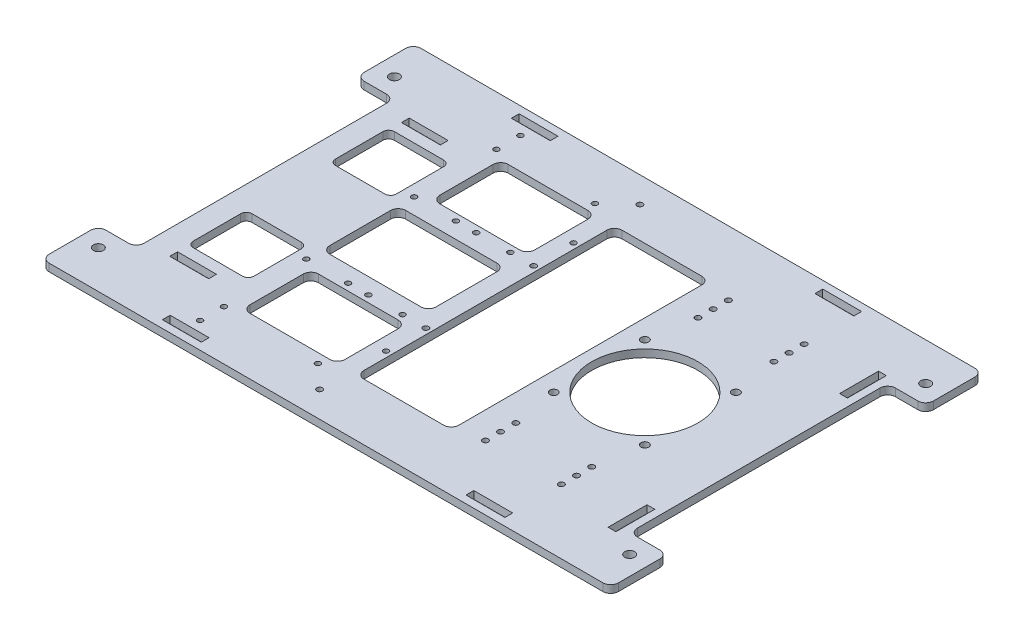
from build123d import *

# Parameters (mm, degrees)
SKETCH_1_R             = 28
SKETCH_1_R_2           = 2.6
SM_BASE_FLANGE_1_DEPTH = 4
CUT_EXTRUDE_1_REACH    = 360.374
SKETCH_6_W             = 4.1
SKETCH_6_H             = 20.5
SKETCH_6_W_2           = 20.5
SKETCH_6_H_2           = 4.1
CUT_EXTRUDE_2_REACH    = 360.374
SKETCH_7_R             = 2.05
SKETCH_14_R            = 1.4
SKETCH_14_R_2          = 1.494707745
SKETCH_14_R_3          = 1.476153091
CUT_EXTRUDE_3_DEPTH    = 359.374106207
SKETCH_15_R            = 1.5
CUT_EXTRUDE_4_DEPTH    = 359.374106207


# Sheet-metal steps are written as plain solids
with BuildPart() as part:
    # Sketch 1 → Базовая кромка1 (new body)
    with BuildSketch(Plane(origin=(0, 0, 0), x_dir=(1, 0, 0), z_dir=(0, 1, 0))):
        with BuildLine():
            Line((0, -170.108474074), (0, -191.891525926))
            ThreePointArc((0, -191.891525926), (1.203344196, -194.796655804), (4.108474074, -196))
            Line((4.108474074, -196), (295.891525926, -196))
            ThreePointArc((295.891525926, -196), (298.796655804, -194.796655804), (300, -191.891525926))
            Line((300, -191.891525926), (300, -170.108474074))
            ThreePointArc((300, -170.108474074), (298.796655804, -167.203344196), (295.891525926, -166))
            Line((295.891525926, -166), (284.108474074, -166))
            ThreePointArc((284.108474074, -166), (281.203344196, -164.796655804), (280, -161.891525926))
            Line((280, -161.891525926), (280, -34.108474074))
            ThreePointArc((280, -34.108474074), (281.203344196, -31.203344196), (284.108474074, -30))
            Line((284.108474074, -30), (295.891525926, -30))
            ThreePointArc((295.891525926, -30), (298.796655804, -28.796655804), (300, -25.891525926))
            Line((300, -25.891525926), (300, -4.108474074))
            ThreePointArc((300, -4.108474074), (298.796655804, -1.203344196), (295.891525926, 0))
            Line((295.891525926, 0), (4.108474074, 0))
            ThreePointArc((4.108474074, 0), (1.203344196, -1.203344196), (0, -4.108474074))
            Line((0, -4.108474074), (0, -25.891525926))
            ThreePointArc((0, -25.891525926), (1.203344196, -28.796655804), (4.108474074, -30))
            Line((4.108474074, -30), (15.891525926, -30))
            ThreePointArc((15.891525926, -30), (18.796655804, -31.203344196), (20, -34.108474074))
            Line((20, -34.108474074), (20, -161.891525926))
            ThreePointArc((20, -161.891525926), (18.796655804, -164.796655804), (15.891525926, -166))
            Line((15.891525926, -166), (4.108474074, -166))
            ThreePointArc((4.108474074, -166), (1.203344196, -167.203344196), (0, -170.108474074))
        make_face()
        with Locations(Location((220, -98, 0), (0, 0, 270))):
            Circle(SKETCH_1_R, mode=Mode.SUBTRACT)
        with Locations(Location((10, -20, 0), (0, 0, 270))):
            Circle(SKETCH_1_R_2, mode=Mode.SUBTRACT)
        with Locations(Location((290, -20, 0), (0, 0, 270))):
            Circle(SKETCH_1_R_2, mode=Mode.SUBTRACT)
        with Locations(Location((290, -176, 0), (0, 0, 90))):
            Circle(SKETCH_1_R_2, mode=Mode.SUBTRACT)
        with Locations(Location((10, -176, 0), (0, 0, 90))):
            Circle(SKETCH_1_R_2, mode=Mode.SUBTRACT)
    extrude(amount=-SM_BASE_FLANGE_1_DEPTH)

    # Эскиз6 → Вырез-Вытянуть1 (cut, up to next)
    with BuildSketch(Plane(origin=(0, 0, 0), x_dir=(1, 0, 0), z_dir=(0, 1, 0)), mode=Mode.PRIVATE) as cut_extrude_1_sk1:
        with Locations((273.95, -37)):
            Rectangle(SKETCH_6_W, SKETCH_6_H)
    cut_extrude_1_tool1 = extrude(cut_extrude_1_sk1.sketch, amount=-CUT_EXTRUDE_1_REACH, mode=Mode.PRIVATE) & part.part
    # Эскиз6 → Вырез-Вытянуть1 (cut, up to next)
    with BuildSketch(Plane(origin=(0, 0, 0), x_dir=(1, 0, 0), z_dir=(0, 1, 0)), mode=Mode.PRIVATE) as cut_extrude_1_sk2:
        with Locations((230, -6.05)):
            Rectangle(SKETCH_6_W_2, SKETCH_6_H_2)
    cut_extrude_1_tool2 = extrude(cut_extrude_1_sk2.sketch, amount=-CUT_EXTRUDE_1_REACH, mode=Mode.PRIVATE) & part.part
    # Эскиз6 → Вырез-Вытянуть1 (cut, up to next)
    with BuildSketch(Plane(origin=(0, 0, 0), x_dir=(1, 0, 0), z_dir=(0, 1, 0)), mode=Mode.PRIVATE) as cut_extrude_1_sk3:
        with Locations((70, -6.05)):
            Rectangle(SKETCH_6_W_2, SKETCH_6_H_2)
    cut_extrude_1_tool3 = extrude(cut_extrude_1_sk3.sketch, amount=-CUT_EXTRUDE_1_REACH, mode=Mode.PRIVATE) & part.part
    # Эскиз6 → Вырез-Вытянуть1 (cut, up to next)
    with BuildSketch(Plane(origin=(0, 0, 0), x_dir=(1, 0, 0), z_dir=(0, 1, 0)), mode=Mode.PRIVATE) as cut_extrude_1_sk4:
        with Locations((43, -36.95)):
            Rectangle(SKETCH_6_W_2, SKETCH_6_H_2)
    cut_extrude_1_tool4 = extrude(cut_extrude_1_sk4.sketch, amount=-CUT_EXTRUDE_1_REACH, mode=Mode.PRIVATE) & part.part
    # Эскиз6 → Вырез-Вытянуть1 (cut, up to next)
    with BuildSketch(Plane(origin=(0, 0, 0), x_dir=(1, 0, 0), z_dir=(0, 1, 0)), mode=Mode.PRIVATE) as cut_extrude_1_sk5:
        with Locations((43, -159.05)):
            Rectangle(SKETCH_6_W_2, SKETCH_6_H_2)
    cut_extrude_1_tool5 = extrude(cut_extrude_1_sk5.sketch, amount=-CUT_EXTRUDE_1_REACH, mode=Mode.PRIVATE) & part.part
    # Эскиз6 → Вырез-Вытянуть1 (cut, up to next)
    with BuildSketch(Plane(origin=(0, 0, 0), x_dir=(1, 0, 0), z_dir=(0, 1, 0)), mode=Mode.PRIVATE) as cut_extrude_1_sk6:
        with Locations((70, -189.95)):
            Rectangle(SKETCH_6_W_2, SKETCH_6_H_2)
    cut_extrude_1_tool6 = extrude(cut_extrude_1_sk6.sketch, amount=-CUT_EXTRUDE_1_REACH, mode=Mode.PRIVATE) & part.part
    # Эскиз6 → Вырез-Вытянуть1 (cut, up to next)
    with BuildSketch(Plane(origin=(0, 0, 0), x_dir=(1, 0, 0), z_dir=(0, 1, 0)), mode=Mode.PRIVATE) as cut_extrude_1_sk7:
        with Locations((230, -189.95)):
            Rectangle(SKETCH_6_W_2, SKETCH_6_H_2)
    cut_extrude_1_tool7 = extrude(cut_extrude_1_sk7.sketch, amount=-CUT_EXTRUDE_1_REACH, mode=Mode.PRIVATE) & part.part
    # Эскиз6 → Вырез-Вытянуть1 (cut, up to next)
    with BuildSketch(Plane(origin=(0, 0, 0), x_dir=(1, 0, 0), z_dir=(0, 1, 0)), mode=Mode.PRIVATE) as cut_extrude_1_sk8:
        with Locations((273.95, -159)):
            Rectangle(SKETCH_6_W, SKETCH_6_H)
    cut_extrude_1_tool8 = extrude(cut_extrude_1_sk8.sketch, amount=-CUT_EXTRUDE_1_REACH, mode=Mode.PRIVATE) & part.part
    add(cut_extrude_1_tool1.solids().sort_by_distance((273.95, 0, 37))[0], mode=Mode.SUBTRACT)
    add(cut_extrude_1_tool2.solids().sort_by_distance((230, 0, 6.05))[0], mode=Mode.SUBTRACT)
    add(cut_extrude_1_tool3.solids().sort_by_distance((70, 0, 6.05))[0], mode=Mode.SUBTRACT)
    add(cut_extrude_1_tool4.solids().sort_by_distance((43, 0, 36.95))[0], mode=Mode.SUBTRACT)
    add(cut_extrude_1_tool5.solids().sort_by_distance((43, 0, 159.05))[0], mode=Mode.SUBTRACT)
    add(cut_extrude_1_tool6.solids().sort_by_distance((70, 0, 189.95))[0], mode=Mode.SUBTRACT)
    add(cut_extrude_1_tool7.solids().sort_by_distance((230, 0, 189.95))[0], mode=Mode.SUBTRACT)
    add(cut_extrude_1_tool8.solids().sort_by_distance((273.95, 0, 159))[0], mode=Mode.SUBTRACT)

    # Эскиз7 → Вырез-Вытянуть2 (cut, up to next)
    with BuildSketch(Plane(origin=(0, 0, 0), x_dir=(1, 0, 0), z_dir=(0, 1, 0)), mode=Mode.PRIVATE) as cut_extrude_2_sk1:
        with Locations(Location((196, -74, 0), (0, 0, 270))):
            Circle(SKETCH_7_R)
    cut_extrude_2_tool1 = extrude(cut_extrude_2_sk1.sketch, amount=-CUT_EXTRUDE_2_REACH, mode=Mode.PRIVATE) & part.part
    # Эскиз7 → Вырез-Вытянуть2 (cut, up to next)
    with BuildSketch(Plane(origin=(0, 0, 0), x_dir=(1, 0, 0), z_dir=(0, 1, 0)), mode=Mode.PRIVATE) as cut_extrude_2_sk2:
        with Locations(Location((244, -74, 0), (0, 0, 270))):
            Circle(SKETCH_7_R)
    cut_extrude_2_tool2 = extrude(cut_extrude_2_sk2.sketch, amount=-CUT_EXTRUDE_2_REACH, mode=Mode.PRIVATE) & part.part
    # Эскиз7 → Вырез-Вытянуть2 (cut, up to next)
    with BuildSketch(Plane(origin=(0, 0, 0), x_dir=(1, 0, 0), z_dir=(0, 1, 0)), mode=Mode.PRIVATE) as cut_extrude_2_sk3:
        with Locations(Location((244, -122, 0), (0, 0, 270))):
            Circle(SKETCH_7_R)
    cut_extrude_2_tool3 = extrude(cut_extrude_2_sk3.sketch, amount=-CUT_EXTRUDE_2_REACH, mode=Mode.PRIVATE) & part.part
    # Эскиз7 → Вырез-Вытянуть2 (cut, up to next)
    with BuildSketch(Plane(origin=(0, 0, 0), x_dir=(1, 0, 0), z_dir=(0, 1, 0)), mode=Mode.PRIVATE) as cut_extrude_2_sk4:
        with Locations(Location((196, -122, 0), (0, 0, 270))):
            Circle(SKETCH_7_R)
    cut_extrude_2_tool4 = extrude(cut_extrude_2_sk4.sketch, amount=-CUT_EXTRUDE_2_REACH, mode=Mode.PRIVATE) & part.part
    # Эскиз7 → Вырез-Вытянуть2 (cut, up to next)
    with BuildSketch(Plane(origin=(0, 0, 0), x_dir=(1, 0, 0), z_dir=(0, 1, 0)), mode=Mode.PRIVATE) as cut_extrude_2_sk5:
        with BuildLine():
            Line((140, -30), (182, -30))
            ThreePointArc((182, -30), (184.828427125, -31.171572875), (186, -34))
            Line((186, -34), (186, -162))
            ThreePointArc((186, -162), (184.828427125, -164.828427125), (182, -166))
            Line((182, -166), (140, -166))
            ThreePointArc((140, -166), (137.171572875, -164.828427125), (136, -162))
            Line((136, -162), (136, -34))
            ThreePointArc((136, -34), (137.171572875, -31.171572875), (140, -30))
        make_face()
    cut_extrude_2_tool5 = extrude(cut_extrude_2_sk5.sketch, amount=-CUT_EXTRUDE_2_REACH, mode=Mode.PRIVATE) & part.part
    # Эскиз7 → Вырез-Вытянуть2 (cut, up to next)
    with BuildSketch(Plane(origin=(0, 0, 0), x_dir=(1, 0, 0), z_dir=(0, 1, 0)), mode=Mode.PRIVATE) as cut_extrude_2_sk6:
        with BuildLine():
            Line((74, -78), (122, -78))
            ThreePointArc((122, -78), (124.828427125, -79.171572875), (126, -82))
            Line((126, -82), (126, -114))
            ThreePointArc((126, -114), (124.828427125, -116.828427125), (122, -118))
            Line((122, -118), (74, -118))
            ThreePointArc((74, -118), (71.171572875, -116.828427125), (70, -114))
            Line((70, -114), (70, -82))
            ThreePointArc((70, -82), (71.171572875, -79.171572875), (74, -78))
        make_face()
    cut_extrude_2_tool6 = extrude(cut_extrude_2_sk6.sketch, amount=-CUT_EXTRUDE_2_REACH, mode=Mode.PRIVATE) & part.part
    # Эскиз7 → Вырез-Вытянуть2 (cut, up to next)
    with BuildSketch(Plane(origin=(0, 0, 0), x_dir=(1, 0, 0), z_dir=(0, 1, 0)), mode=Mode.PRIVATE) as cut_extrude_2_sk7:
        with BuildLine():
            Line((35, -45), (61, -45))
            ThreePointArc((61, -45), (63.121320344, -45.878679656), (64, -48))
            Line((64, -48), (64, -73))
            ThreePointArc((64, -73), (63.121320344, -75.121320344), (61, -76))
            Line((61, -76), (35, -76))
            ThreePointArc((35, -76), (32.878679656, -75.121320344), (32, -73))
            Line((32, -73), (32, -48))
            ThreePointArc((32, -48), (32.878679656, -45.878679656), (35, -45))
        make_face()
    cut_extrude_2_tool7 = extrude(cut_extrude_2_sk7.sketch, amount=-CUT_EXTRUDE_2_REACH, mode=Mode.PRIVATE) & part.part
    # Эскиз7 → Вырез-Вытянуть2 (cut, up to next)
    with BuildSketch(Plane(origin=(0, 0, 0), x_dir=(1, 0, 0), z_dir=(0, 1, 0)), mode=Mode.PRIVATE) as cut_extrude_2_sk8:
        with BuildLine():
            Line((64, -148), (64, -123))
            ThreePointArc((64, -123), (63.121320344, -120.878679656), (61, -120))
            Line((61, -120), (35, -120))
            ThreePointArc((35, -120), (32.878679656, -120.878679656), (32, -123))
            Line((32, -123), (32, -148))
            ThreePointArc((32, -148), (32.878679656, -150.121320344), (35, -151))
            Line((35, -151), (61, -151))
            ThreePointArc((61, -151), (63.121320344, -150.121320344), (64, -148))
        make_face()
    cut_extrude_2_tool8 = extrude(cut_extrude_2_sk8.sketch, amount=-CUT_EXTRUDE_2_REACH, mode=Mode.PRIVATE) & part.part
    add(cut_extrude_2_tool1.solids().sort_by_distance((196, 0, 74))[0], mode=Mode.SUBTRACT)
    add(cut_extrude_2_tool2.solids().sort_by_distance((244, 0, 74))[0], mode=Mode.SUBTRACT)
    add(cut_extrude_2_tool3.solids().sort_by_distance((244, 0, 122))[0], mode=Mode.SUBTRACT)
    add(cut_extrude_2_tool4.solids().sort_by_distance((196, 0, 122))[0], mode=Mode.SUBTRACT)
    add(cut_extrude_2_tool5.solids().sort_by_distance((161, 0, 98))[0], mode=Mode.SUBTRACT)
    add(cut_extrude_2_tool6.solids().sort_by_distance((98, 0, 98))[0], mode=Mode.SUBTRACT)
    add(cut_extrude_2_tool7.solids().sort_by_distance((48, 0, 60.5))[0], mode=Mode.SUBTRACT)
    add(cut_extrude_2_tool8.solids().sort_by_distance((48, 0, 135.5))[0], mode=Mode.SUBTRACT)

    # Эскиз14 → Вырез-Вытянуть3 (cut, through all)
    with BuildSketch(Plane(origin=(0, 0, 0), x_dir=(1, 0, 0), z_dir=(0, 1, 0))):
        with Locations(Location((70, -26.2, 0), (0, 0, 270))):
            Circle(SKETCH_14_R)
        with Locations(Location((120.7, -25, 0), (0, 0, 270))):
            Circle(SKETCH_14_R)
        with Locations(Location((70, -69.6, 0), (0, 0, 270))):
            Circle(SKETCH_14_R)
        with Locations(Location((120.7, -69.6, 0), (0, 0, 270))):
            Circle(SKETCH_14_R)
        with Locations(Location((70, -13.6, 0), (0, 0, 270))):
            Circle(SKETCH_14_R)
        with Locations(Location((133, -13.6, 0), (0, 0, 270))):
            Circle(SKETCH_14_R_2)
        with Locations(Location((133, -69.6, 0), (0, 0, 270))):
            Circle(SKETCH_14_R_3)
        with Locations(Location((133, -126.4, 0), (0, 0, 90))):
            Circle(SKETCH_14_R_3)
        with Locations(Location((133, -182.4, 0), (0, 0, 90))):
            Circle(SKETCH_14_R_2)
        with Locations(Location((70, -182.4, 0), (0, 0, 90))):
            Circle(SKETCH_14_R)
        with Locations(Location((120.7, -126.4, 0), (0, 0, 90))):
            Circle(SKETCH_14_R)
        with Locations(Location((70, -126.4, 0), (0, 0, 90))):
            Circle(SKETCH_14_R)
        with Locations(Location((120.7, -171, 0), (0, 0, 90))):
            Circle(SKETCH_14_R)
        with Locations(Location((70, -169.8, 0), (0, 0, 90))):
            Circle(SKETCH_14_R)
        with Locations(Location((133, -48.6, 0), (0, 0, 270))):
            Circle(SKETCH_14_R)
        with Locations(Location((92, -69.6, 0), (0, 0, 270))):
            Circle(SKETCH_14_R)
        with Locations((61.7, -48.6)):
            Circle(SKETCH_14_R)
        with Locations(Location((102.7, -69.6, 0), (0, 0, 270))):
            Circle(SKETCH_14_R)
        with Locations(Location((102.7, -126.4, 0), (0, 0, 90))):
            Circle(SKETCH_14_R)
        with Locations(Location((92, -126.4, 0), (0, 0, 90))):
            Circle(SKETCH_14_R)
        with Locations(Location((133, -147.4, 0), (0, 0, 90))):
            Circle(SKETCH_14_R)
        with Locations((61.7, -147.4)):
            Circle(SKETCH_14_R)
        with BuildLine():
            Line((80, -30), (122, -30))
            ThreePointArc((122, -30), (124.828427125, -31.171572875), (126, -34))
            Line((126, -34), (126, -62))
            ThreePointArc((126, -62), (124.828427125, -64.828427125), (122, -66))
            Line((122, -66), (80, -66))
            ThreePointArc((80, -66), (77.171572875, -64.828427125), (76, -62))
            Line((76, -62), (76, -34))
            ThreePointArc((76, -34), (77.171572875, -31.171572875), (80, -30))
        make_face()
        with BuildLine():
            Line((126, -162), (126, -134))
            ThreePointArc((126, -134), (124.828427125, -131.171572875), (122, -130))
            Line((122, -130), (80, -130))
            ThreePointArc((80, -130), (77.171572875, -131.171572875), (76, -134))
            Line((76, -134), (76, -162))
            ThreePointArc((76, -162), (77.171572875, -164.828427125), (80, -166))
            Line((80, -166), (122, -166))
            ThreePointArc((122, -166), (124.828427125, -164.828427125), (126, -162))
        make_face()
    extrude(amount=-CUT_EXTRUDE_3_DEPTH, mode=Mode.SUBTRACT)

    # Эскиз15 → Вырез-Вытянуть4 (cut, through all)
    with BuildSketch(Plane(origin=(0, 0, 0), x_dir=(1, 0, 0), z_dir=(0, 1, 0))):
        with Locations(Location((200, -34, 0), (0, 0, 270))):
            Circle(SKETCH_15_R)
        with Locations(Location((240, -34, 0), (0, 0, 270))):
            Circle(SKETCH_15_R)
        with Locations(Location((240, -42, 0), (0, 0, 270))):
            Circle(SKETCH_15_R)
        with Locations(Location((240, -50, 0), (0, 0, 270))):
            Circle(SKETCH_15_R)
        with Locations(Location((200, -42, 0), (0, 0, 270))):
            Circle(SKETCH_15_R)
        with Locations(Location((200, -50, 0), (0, 0, 270))):
            Circle(SKETCH_15_R)
        with Locations(Location((200, -146, 0), (0, 0, 90))):
            Circle(SKETCH_15_R)
        with Locations(Location((200, -154, 0), (0, 0, 90))):
            Circle(SKETCH_15_R)
        with Locations(Location((240, -146, 0), (0, 0, 90))):
            Circle(SKETCH_15_R)
        with Locations(Location((240, -154, 0), (0, 0, 90))):
            Circle(SKETCH_15_R)
        with Locations(Location((240, -162, 0), (0, 0, 90))):
            Circle(SKETCH_15_R)
        with Locations(Location((200, -162, 0), (0, 0, 90))):
            Circle(SKETCH_15_R)
    extrude(amount=-CUT_EXTRUDE_4_DEPTH, mode=Mode.SUBTRACT)


solid = part.part
